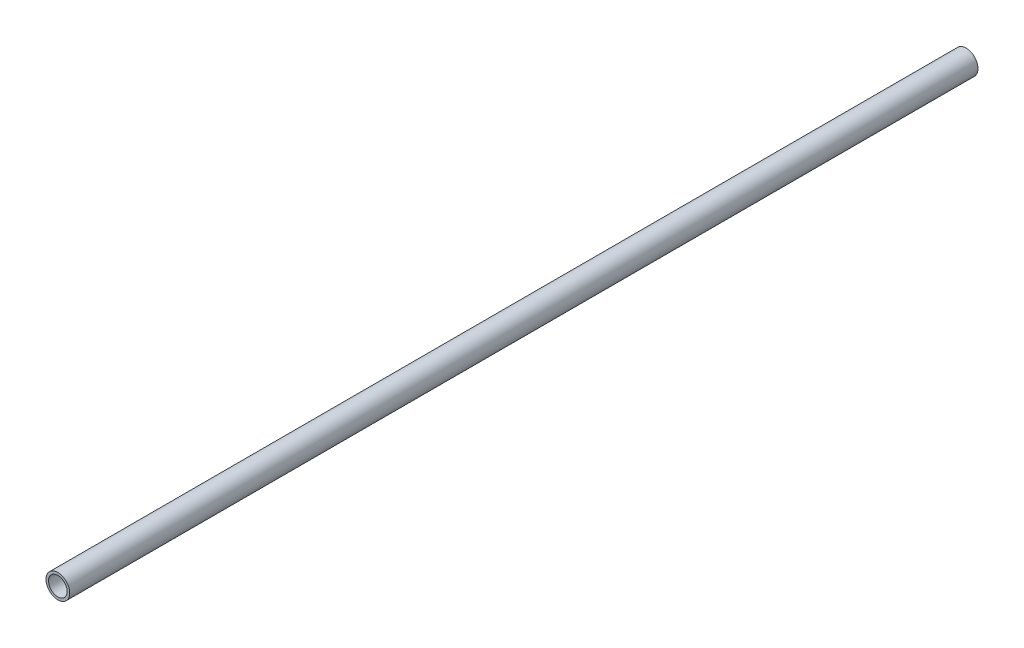
from build123d import *

# Parameters (mm, degrees)
SKETCH1_R           = 11.11
SKETCH1_R_2         = 8.73
BOSS_EXTRUDE1_DEPTH = 850


with BuildPart() as part:
    # Sketch1 → Boss-Extrude1 (new body)
    with BuildSketch(Plane.XY):
        Circle(SKETCH1_R)
        Circle(SKETCH1_R_2, mode=Mode.SUBTRACT)
    extrude(amount=BOSS_EXTRUDE1_DEPTH)


solid = part.part
